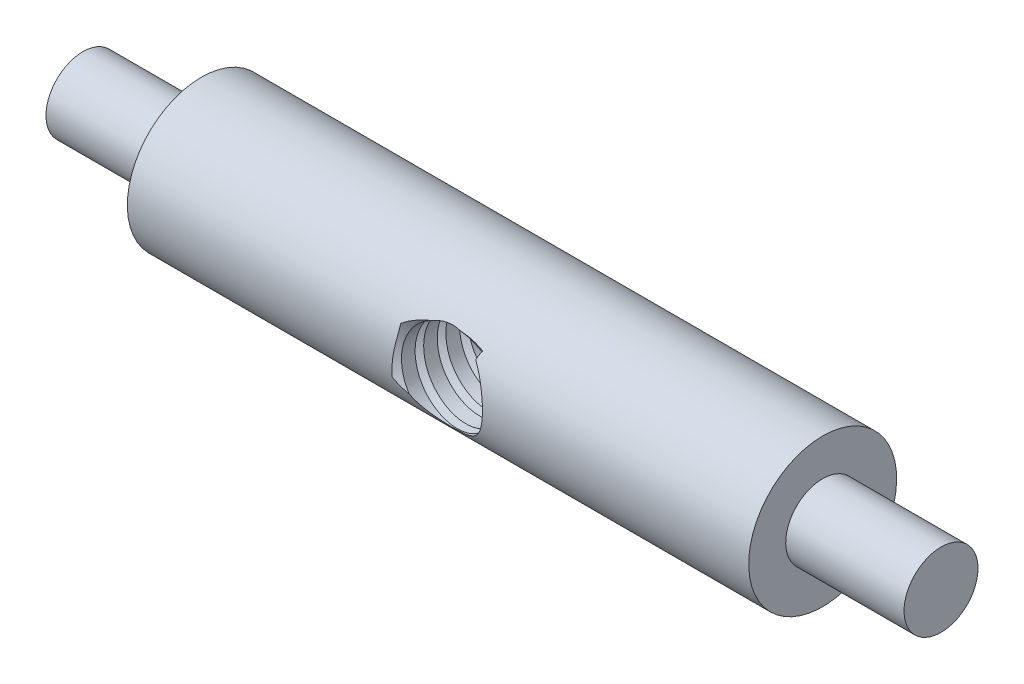
from build123d import *

# Parameters (mm, degrees)
SKETCH_3_R          = 3
CUT_EXTRUDE_1_DEPTH = 10
SWEEP_6_PITCH       = 1.5


with BuildPart() as part:
    # 草圖1 → 旋轉1 (revolve)
    with BuildSketch(Plane.XY):
        Polygon((-29, 0), (-29, 2.5), (-21, 2.5), (-21, 5), (21, 5), (21, 2.5), (29, 2.5), (29, 0), align=None)
    revolve(axis=Axis((29, 0, 0), (-1, 0, 0)))

    # 草圖3 → 除料-伸長1 (cut, symmetric)
    with BuildSketch(Plane.XY):
        Circle(SKETCH_3_R)
    extrude(amount=CUT_EXTRUDE_1_DEPTH, both=True, mode=Mode.SUBTRACT)

    # 除料-掃出6: the profile of 草圖17 screwed along a right-hand helix of 10 turns, 8 arcs to a turn; built about Z, then put on its axis
    sweep_6_z = Axis((0, 0, 0), (0, 0, 1))
    sweep_6_corners = [(3.5, 0, 0), (1.767949192, 0, 1), (1.767949192, 0, -1)]
    with BuildLine(mode=Mode.PRIVATE) as sweep_6_profile:
        Line(sweep_6_corners[0], sweep_6_corners[1])
        Line(sweep_6_corners[1], sweep_6_corners[2])
        Line(sweep_6_corners[2], sweep_6_corners[0])
    sweep_6_cap = Face(sweep_6_profile.wire())
    sweep_6_turn_angles = [0, 22.5, 45, 67.5, 90, 112.5, 135, 157.5, 180, 202.5, 225, 247.5, 270, 292.5, 315, 337.5, 360]
    sweep_6_turn_weights = [1, 0.9238795325112867, 1, 0.9238795325112867, 1, 0.9238795325112867, 1, 0.9238795325112867, 1, 0.9238795325112867, 1, 0.9238795325112867, 1, 0.9238795325112867, 1, 0.9238795325112867, 1]
    sweep_6_turn_rails = [Edge.make_bspline([Vector(p[0], p[1], 0).rotate(sweep_6_z, sweep_6_turn_angles[k]) / sweep_6_turn_weights[k] + Vector(0, 0, p[2] + SWEEP_6_PITCH * sweep_6_turn_angles[k] / 360) for k in range(17)], [0, 0, 0, 1, 1, 2, 2, 3, 3, 4, 4, 5, 5, 6, 6, 7, 7, 8, 8, 8], 2, sweep_6_turn_weights) for p in sweep_6_corners]
    sweep_6_turn_sides = [Face.make_surface_from_curves(sweep_6_turn_rails[p[0]], sweep_6_turn_rails[p[1]]) for p in [(0, 1), (1, 2), (2, 0)]]
    sweep_6 = Plane(origin=(0, 0, 7), x_dir=(1, 0, 0), z_dir=(0, 0, -1)) * Solid(Shell([*[p.moved(Location((0, 0, SWEEP_6_PITCH * i))) for i in range(10) for p in sweep_6_turn_sides], sweep_6_cap, sweep_6_cap.rotate(sweep_6_z, 3600).moved(Location((0, 0, SWEEP_6_PITCH * 3600 / 360)))]))
    add(sweep_6, mode=Mode.SUBTRACT)


solid = part.part
